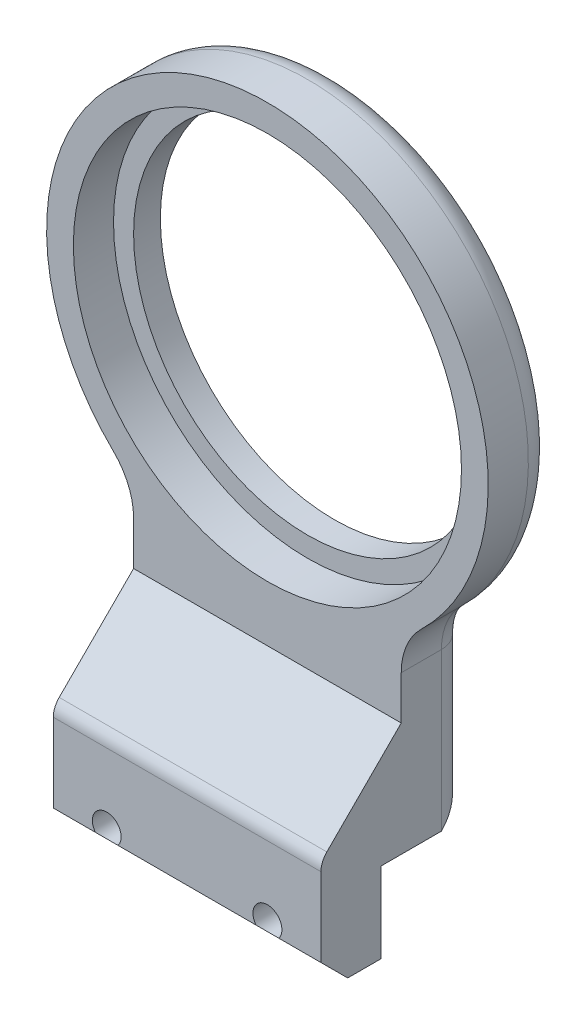
from build123d import *

# Parameters (mm, degrees)
SKETCH_1_R          = 26
EXTRUDE_1_DEPTH     = 10
SKETCH_3_R          = 29
CUT_EXTRUDE_1_DEPTH = 6
SKETCH_4_W          = 40
SKETCH_4_H          = 12
EXTRUDE_2_DEPTH     = 12
SKETCH_5_W          = 40
SKETCH_5_H          = 12
EXTRUDE_3_DEPTH     = 2
SKETCH_6_W          = 40
SKETCH_6_H          = 12
EXTRUDE_4_DEPTH     = 3
CHAMFER_1_SIZE      = 14
SKETCH_7_R          = 1.7
CUT_EXTRUDE_2_DEPTH = 14
SKETCH_8_R          = 2.15
SKETCH_8_R_2        = 2.165
CUT_EXTRUDE_3_DEPTH = 6
SKETCH_9_W          = 40
SKETCH_9_H          = 12
CUT_EXTRUDE_4_DEPTH = 5
CHAMFER_2_SIZE      = 4
CHAMFER_3_SIZE      = 4
FILLET_5_R          = 10
FILLET_6_R          = 4
FILLET_7_R          = 3


with BuildPart() as part:
    # 草图1 → 凸台-拉伸1 (new body)
    with BuildSketch(Plane.XY):
        with BuildLine():
            Line((20, -27.158003748), (-20, -27.158003748))
            Line((-20, -27.158003748), (-20, 0.909194251))
            ThreePointArc((-20, 0.909194251), (0, 60.158003748), (20, 0.909194251))
            Line((20, 0.909194251), (20, -27.158003748))
        make_face()
        with Locations((0, 27.158003748)):
            Circle(SKETCH_1_R, mode=Mode.SUBTRACT)
    extrude(amount=EXTRUDE_1_DEPTH)

    # 草图3 → 切除-拉伸1 (cut)
    with BuildSketch(Plane.XY.offset(10)):
        with Locations((0, 27.158003748)):
            Circle(SKETCH_3_R)
    extrude(amount=-CUT_EXTRUDE_1_DEPTH, mode=Mode.SUBTRACT)



with BuildPart() as body_2:
    # 草图4 → 凸台-拉伸2 (new body)
    with BuildSketch(Plane.XY.offset(10)):
        with Locations((0, -33.158003748)):
            Rectangle(SKETCH_4_W, SKETCH_4_H)
    extrude(amount=EXTRUDE_2_DEPTH)


with BuildPart() as part_1:
    add(part.part)

    add(body_2.part)  # 凸台-拉伸3 merges body 2
    # 草图5 → 凸台-拉伸3 (add)
    with BuildSketch(Plane(origin=(0, 0, 10), x_dir=(-1, 0, 0), z_dir=(0, 0, -1))):
        with Locations((0, -33.158003748)):
            Rectangle(SKETCH_5_W, SKETCH_5_H)
    extrude(amount=EXTRUDE_3_DEPTH)

    # 草图6 → 凸台-拉伸4 (add)
    with BuildSketch(Plane(origin=(0, -27.158003748, 0), x_dir=(1, 0, 0), z_dir=(0, 1, 0))):
        with Locations((0, -16)):
            Rectangle(SKETCH_6_W, SKETCH_6_H)
    extrude(amount=EXTRUDE_4_DEPTH)

    # 倒角1
    # the kernel refuses this chamfer: 14 mm, written as the material it adds along each edge
    with BuildSketch(Plane(origin=(-20, -24.158003748, 10), x_dir=(0, -0.027495876610586365, 0.9996219169112968), z_dir=(1, 0, 0))) as chamfer_1_piece_1_section:
        Polygon((CHAMFER_1_SIZE * 0.999621916911, -CHAMFER_1_SIZE * 0.0274958766106), (-CHAMFER_1_SIZE * 0.0274958766106, -CHAMFER_1_SIZE * 0.999621916911), (0, 0), align=None)
    chamfer_1_piece_1 = extrude(amount=40, mode=Mode.PRIVATE)
    chamfer_1_piece_1 = split(chamfer_1_piece_1, bisect_by=Plane(origin=(0, -19.403075602, 22), z_dir=(0, 0, -1)), keep=Keep.TOP, mode=Mode.PRIVATE)
    add(chamfer_1_piece_1)

    # 草图7 → 切除-拉伸2 (cut)
    with BuildSketch(Plane(origin=(0, 0, 8), x_dir=(-1, 0, 0), z_dir=(0, 0, -1))):
        with Locations((-12, -33.833568363)):
            Circle(SKETCH_7_R)
        with Locations((12.012999622, -33.833568363)):
            Circle(SKETCH_7_R)
    extrude(amount=-CUT_EXTRUDE_2_DEPTH, mode=Mode.SUBTRACT)

    # 草图8 → 切除-拉伸3 (cut)
    with BuildSketch(Plane.XY.offset(22)):
        with Locations((-12.012999622, -33.833568363)):
            Circle(SKETCH_8_R)
        with Locations((12, -33.833568363)):
            Circle(SKETCH_8_R_2)
    extrude(amount=-CUT_EXTRUDE_3_DEPTH, mode=Mode.SUBTRACT)

    # 草图9 → 切除-拉伸4 (cut)
    with BuildSketch(Plane(origin=(0, 0, 8), x_dir=(-1, 0, 0), z_dir=(0, 0, -1))):
        with Locations((0, -33.158003748)):
            Rectangle(SKETCH_9_W, SKETCH_9_H)
    extrude(amount=-CUT_EXTRUDE_4_DEPTH, mode=Mode.SUBTRACT)

    # 倒角2
    # the kernel refuses this chamfer: 4 mm, written as the material it takes off along each edge
    with BuildSketch(Plane(origin=(30.286731952, -39.158003748, 22), x_dir=(0, 0.9996219169112968, 0.02749587661058651), z_dir=(-1, 0, 0))) as chamfer_2_piece_1:
        Polygon((CHAMFER_2_SIZE * 0.999621916911, CHAMFER_2_SIZE * 0.0274958766106), (-CHAMFER_2_SIZE * 0.0274958766106, CHAMFER_2_SIZE * 0.999621916911), (0, 0), align=None)
    extrude(amount=60.573463904, mode=Mode.SUBTRACT)

    # 倒角3
    chamfer_3_edges = [part_1.edges().sort_by_distance(p)[0] for p in [
        (0, -27.158003748, 0),
    ]]
    chamfer(chamfer_3_edges, length=CHAMFER_3_SIZE)

    # 圆角5
    fillet_5_edges = [part_1.edges().sort_by_distance(p)[0] for p in [
        (-20, 0.909194251, 5),
        (20, 0.909194251, 5),
    ]]
    fillet(fillet_5_edges, radius=FILLET_5_R)

    # 圆角6
    fillet_6_edges = [part_1.edges().sort_by_distance(p)[0] for p in [
        (0, 60.158003748, 0),
        (-20, -13.402921801, 0),
        (-20.786763819, 0.240126076, 0),
        (20.786763819, 0.240126076, 0),
        (20, -13.402921801, 0),
    ]]
    fillet(fillet_6_edges, radius=FILLET_6_R)

    # 圆角7
    fillet_7_edges = [part_1.edges().sort_by_distance(p)[0] for p in [
        (0, -22.158003748, 22),
    ]]
    fillet(fillet_7_edges, radius=FILLET_7_R)


solid = part_1.part
